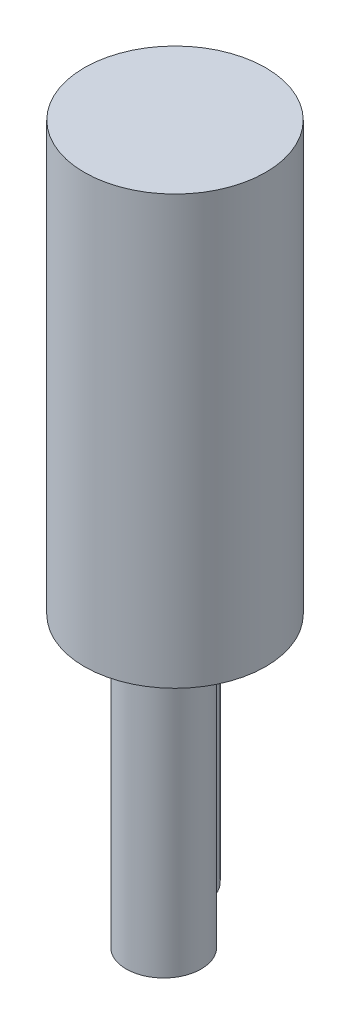
from build123d import *

# Parameters (mm, degrees)
SKETCH1_R           = 169.5
BOSS_EXTRUDE1_DEPTH = 800
SKETCH2_R           = 70
BOSS_EXTRUDE2_DEPTH = 490


with BuildPart() as part:
    # Sketch1 → Boss-Extrude1 (new body)
    with BuildSketch(Plane(origin=(0, 0, 0), x_dir=(1, 0, 0), z_dir=(0, 1, 0))):
        Circle(SKETCH1_R)
    extrude(amount=BOSS_EXTRUDE1_DEPTH)

    # Sketch2 → Boss-Extrude2 (add)
    with BuildSketch(Plane.XZ):
        with Locations((-63.871878151, -49.558478811)):
            Circle(SKETCH2_R)
        with Locations((38.753875996, 59.90396521)):
            Circle(SKETCH2_R)
    extrude(amount=BOSS_EXTRUDE2_DEPTH)


solid = part.part
